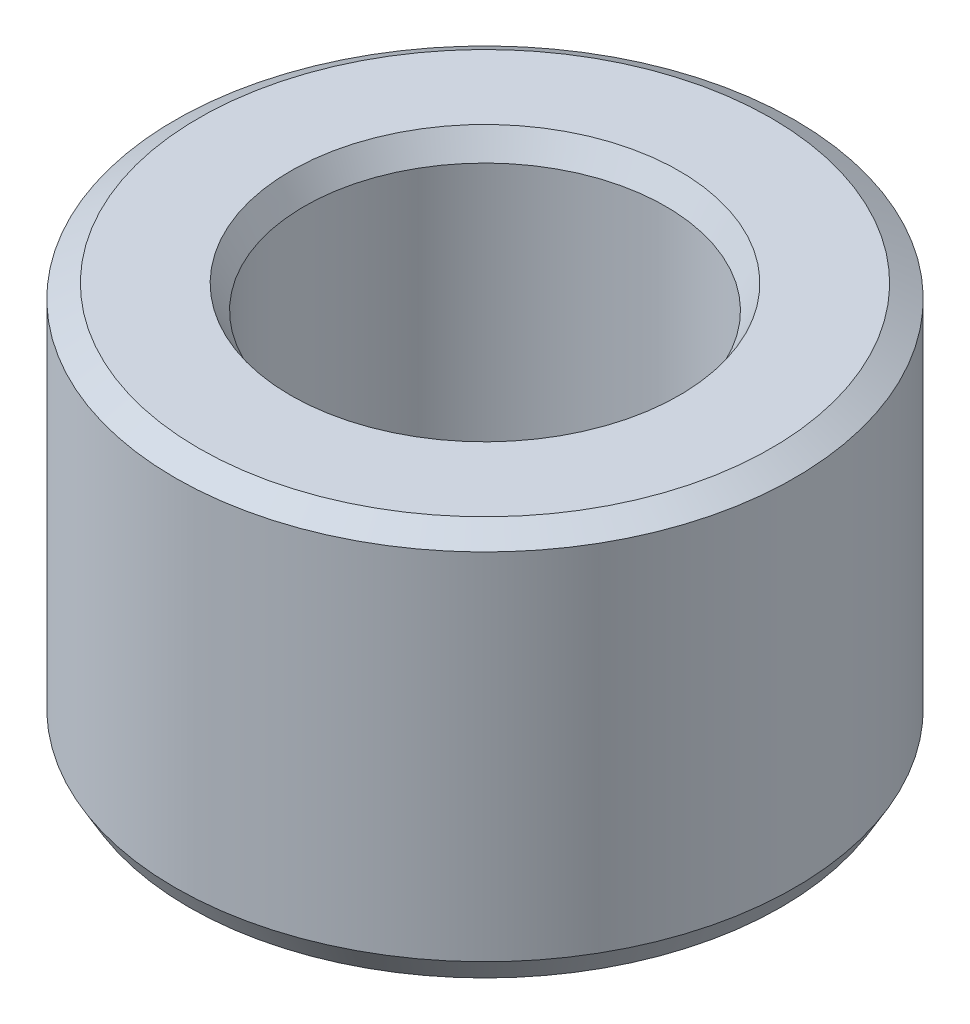
from build123d import *
from OCP.BRepFilletAPI import BRepFilletAPI_MakeChamfer

# Parameters (mm, degrees)
SKETCH1_R           = 57.5
BOSS_EXTRUDE1_DEPTH = 72.799545163
SKETCH2_R           = 33.52461263
CUT_EXTRUDE1_DEPTH  = 110.143363408
CHAMFER1_SIZE       = 2.542817841
CHAMFER1_SIZE2      = 4.404289694


with BuildPart() as part:
    # Sketch1 → Boss-Extrude1 (new body)
    with BuildSketch(Plane(origin=(0, 0, 0), x_dir=(1, 0, 0), z_dir=(0, 1, 0))):
        Circle(SKETCH1_R)
    extrude(amount=BOSS_EXTRUDE1_DEPTH)

    # Sketch2 → Cut-Extrude1 (cut, through all)
    with BuildSketch(Plane(origin=(0, 0, 0), x_dir=(1, 0, 0), z_dir=(0, 1, 0))):
        Circle(SKETCH2_R)
    extrude(amount=CUT_EXTRUDE1_DEPTH, mode=Mode.SUBTRACT)

    # Chamfer1: one chamfer whose edges measure the first distance from different faces: ONE call of the kernel's chamfer builder (chamfer() names one face for all edges)
    chamfer1_edges_1 = [part.edges().sort_by_distance(p)[0] for p in [
        (-33.52461263, 72.799545163, 0),
    ]]
    chamfer1_side_1 = [part.faces().sort_by_distance(p)[0] for p in [
        (-55.873654403, 72.799545163, 0),
    ]]
    chamfer1_edges_2 = [part.edges().sort_by_distance(p)[0] for p in [
        (-33.52461263, 0, 0),
    ]]
    chamfer1_side_2 = [part.faces().sort_by_distance(p)[0] for p in [
        (-33.52461263, 36.399772581, 0),
    ]]
    chamfer1_edges_3 = [part.edges().sort_by_distance(p)[0] for p in [
        (-57.5, 0, 0),
    ]]
    chamfer1_side_3 = [part.faces().sort_by_distance(p)[0] for p in [
        (-55.873654403, 0, 0),
    ]]
    chamfer1_edges_4 = [part.edges().sort_by_distance(p)[0] for p in [
        (-57.5, 72.799545163, 0),
    ]]
    chamfer1_side_4 = [part.faces().sort_by_distance(p)[0] for p in [
        (-57.5, 36.399772581, 0),
    ]]
    chamfer1 = BRepFilletAPI_MakeChamfer(part.part.solid().wrapped)
    for e in chamfer1_edges_1:
        chamfer1.Add(CHAMFER1_SIZE, CHAMFER1_SIZE2, e.wrapped, chamfer1_side_1[0].wrapped)  # the first distance lies on this face
    for e in chamfer1_edges_2:
        chamfer1.Add(CHAMFER1_SIZE, CHAMFER1_SIZE2, e.wrapped, chamfer1_side_2[0].wrapped)  # the first distance lies on this face
    for e in chamfer1_edges_3:
        chamfer1.Add(CHAMFER1_SIZE, CHAMFER1_SIZE2, e.wrapped, chamfer1_side_3[0].wrapped)  # the first distance lies on this face
    for e in chamfer1_edges_4:
        chamfer1.Add(CHAMFER1_SIZE, CHAMFER1_SIZE2, e.wrapped, chamfer1_side_4[0].wrapped)  # the first distance lies on this face
    add(Compound.cast(chamfer1.Shape()), mode=Mode.REPLACE)


solid = part.part
